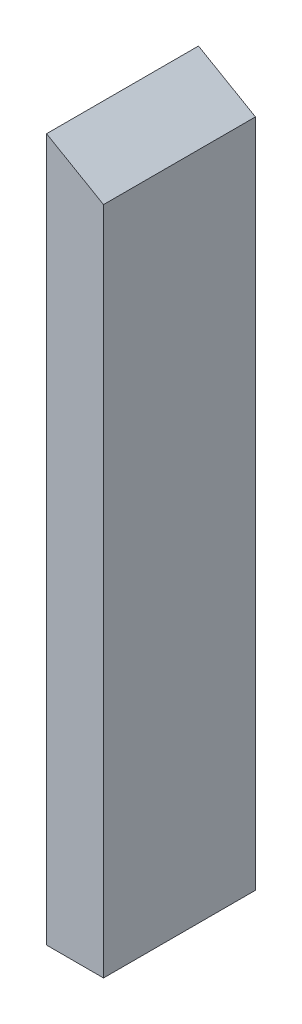
from build123d import *

# Parameters (mm, degrees)
BOSS_EXTRUDE1_DEPTH = 8


with BuildPart() as part:
    # Sketch1 → Boss-Extrude1 (new body)
    with BuildSketch(Plane.XY):
        Polygon((-19.436056893, 59.579396178), (-16.436056893, 57.84734537), (-16.436056893, 22.579396178), (-19.436056893, 22.579396178), align=None)
    extrude(amount=BOSS_EXTRUDE1_DEPTH)


solid = part.part
